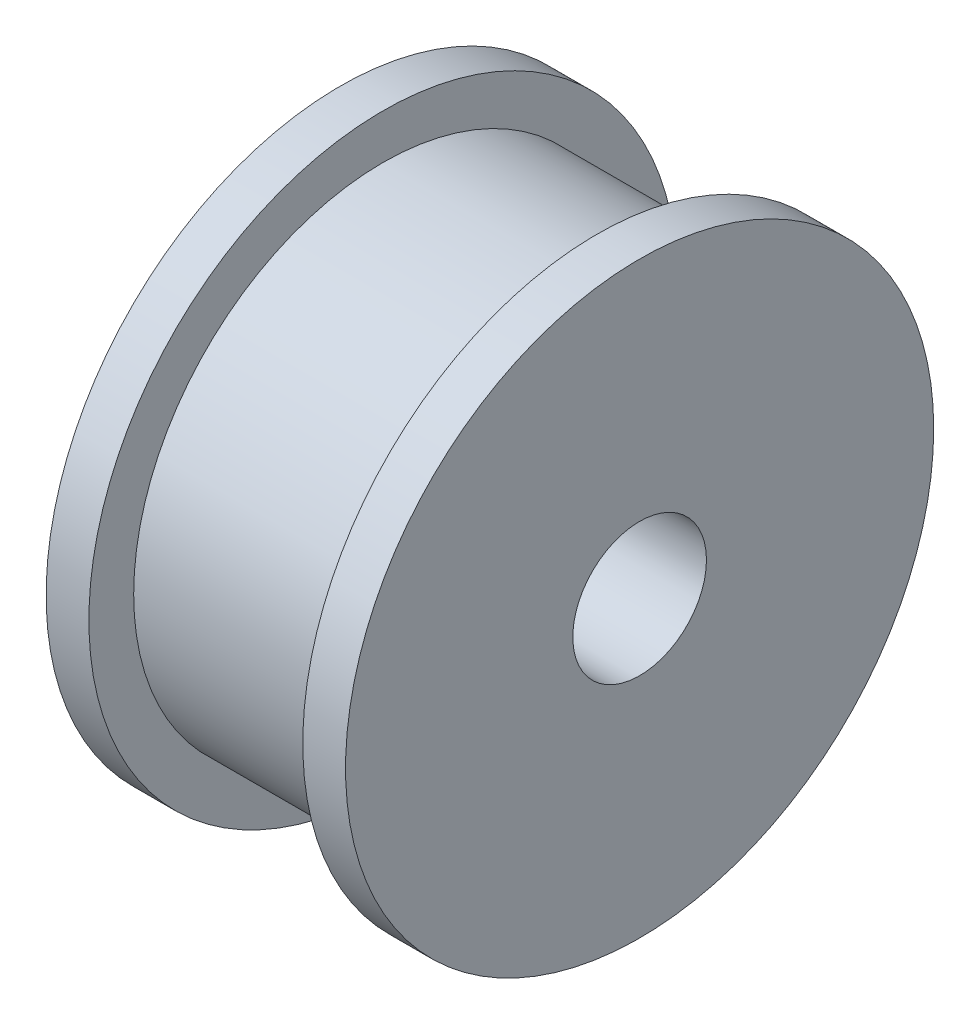
from build123d import *


with BuildPart() as part:
    # Sketch1 → Revolve1 (revolve)
    with BuildSketch(Plane.XY):
        Polygon((-5.6, 11), (-4, 11), (-4, 9.325), (4, 9.325), (4, 11), (5.6, 11), (5.6, 2.5), (-5.6, 2.5), align=None)
    revolve(axis=Axis((0, 0, 0), (-1, 0, 0)))


solid = part.part
